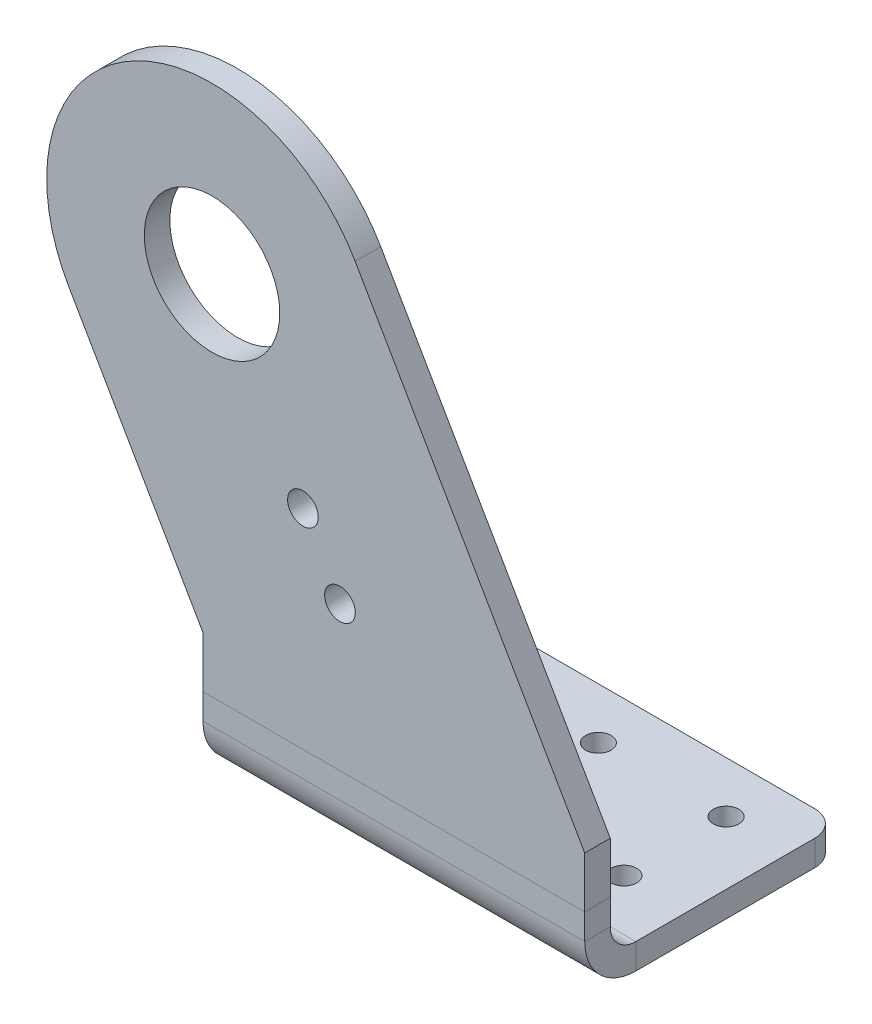
from build123d import *

# Parameters (mm, degrees)
SKETCH_1_R             = 13.25
SKETCH_1_R_2           = 3
EXTRUDE_1_DEPTH        = 5
SM_BASE_FLANGE_1_DEPTH = 74.681955
SKETCH_8_R             = 2.5
CUT_EXTRUDE_1_DEPTH    = 134.765093758
FILLET_1_R             = 5


# Sheet-metal steps are written as plain solids
with BuildPart() as part:
    # Sketch 1 → 凸台-拉伸1 (new body)
    with BuildSketch(Plane.XY):
        with BuildLine():
            Line((-49.360062144, -0.241015089), (-23.122201524, -45.686322765))
            Line((-23.122201524, -45.686322765), (-23.122201524, -55.686322765))
            Line((-23.122201524, -55.686322765), (51.559753885, -55.686322765))
            Line((51.559753885, -55.686322765), (51.559753885, -45.686322765))
            Line((51.559753885, -45.686322765), (6.651404412, 32.097220205))
            ThreePointArc((6.651404412, 32.097220205), (-37.523446513, 43.933835837), (-49.360062144, -0.241015089))
        make_face()
        with Locations((-21.354328866, 15.928102558)):
            Circle(SKETCH_1_R, mode=Mode.SUBTRACT)
        with Locations((-3.567776343, -14.879110103)):
            Circle(SKETCH_1_R_2, mode=Mode.SUBTRACT)
        with Locations((3.675910259, -27.425543331)):
            Circle(SKETCH_1_R_2, mode=Mode.SUBTRACT)
    extrude(amount=EXTRUDE_1_DEPTH)


with BuildPart() as body_2:
    # 草图3 → 基体-法兰1 (new body)
    with BuildSketch(Plane(origin=(51.559753885, 0, 0), x_dir=(0, 0, -1), z_dir=(1, 0, 0))):
        with BuildLine():
            Line((0, -55.686322765), (0, -60.686322765))
            ThreePointArc((0, -60.686322765), (1.464466094, -64.221856671), (5, -65.686322765))
            Line((5, -65.686322765), (45, -65.686322765))
            Line((45, -65.686322765), (45, -70.686322765))
            Line((45, -70.686322765), (5, -70.686322765))
            ThreePointArc((5, -70.686322765), (-2.071067812, -67.757390577), (-5, -60.686322765))
            Line((-5, -60.686322765), (-5, -55.686322765))
            Line((-5, -55.686322765), (0, -55.686322765))
        make_face()
    extrude(amount=-SM_BASE_FLANGE_1_DEPTH)

    # 草图8 → 切除-拉伸1 (cut, through all)
    with BuildSketch(Plane(origin=(0, -65.686322765, 0), x_dir=(1, 0, 0), z_dir=(0, 1, 0))):
        with Locations(Location((14.21877618, 35, 0), (0, 0, 180))):
            Circle(SKETCH_8_R)
        with Locations(Location((-10.78122382, 35, 0), (0, 0, 180))):
            Circle(SKETCH_8_R)
        with Locations(Location((-10.78122382, 15, 0), (0, 0, 180))):
            Circle(SKETCH_8_R)
        with Locations((39.21877618, 15)):
            Circle(SKETCH_8_R)
        with Locations((39.21877618, 35)):
            Circle(SKETCH_8_R)
        with Locations(Location((14.21877618, 15, 0), (0, 0, 180))):
            Circle(SKETCH_8_R)
    extrude(amount=-CUT_EXTRUDE_1_DEPTH, mode=Mode.SUBTRACT)

    # 圆角1
    fillet_1_edges = [body_2.edges().sort_by_distance(p)[0] for p in [
        (-23.122201115, -68.186322765, -45),
        (51.559753885, -68.186322765, -45),
    ]]
    fillet(fillet_1_edges, radius=FILLET_1_R)


solid = Compound([part.part, body_2.part])
